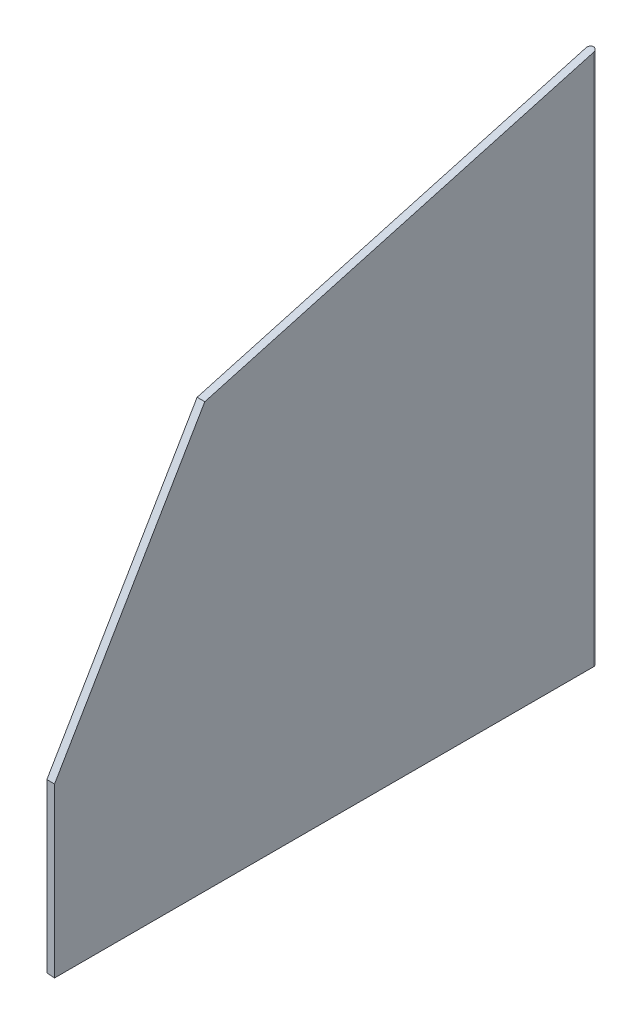
from build123d import *

# Parameters (mm, degrees)
BOSS_EXTRU_1_DEPTH           = 20
ENL_V_MAT_EXTRU_1_DEPTH      = 871
ENL_V_MAT_EXTRU_1_DEPTH_BACK = 792
ESQUISSE5_R                  = 5
ENL_V_MAT_EXTRU_2_DEPTH      = 20
CONG_1_R                     = 10


with BuildPart() as part:
    # Esquisse1 → Boss.-Extru.1 (new body)
    with BuildSketch(Plane(origin=(0, 0, 0), x_dir=(0, 0, -1), z_dir=(1, 0, 0))):
        Polygon((635.709590149, 813.74559194), (-385.471678665, 529.511856746), (-776.290409851, -136.25440806), (-776.290409851, -573.25440806), (635.709590149, -573.25440806), align=None)
    extrude(amount=BOSS_EXTRU_1_DEPTH)

    # Esquisse4 → Enlèv. mat.-Extru.1 (cut, two sides: drawn at the far end of the back side and taken through both)
    with BuildSketch(Plane.XY.offset(-ENL_V_MAT_EXTRU_1_DEPTH_BACK)):
        Polygon((0, -573.25440806), (0, -571.922503428), (20, -573.25440806), align=None)
    extrude(amount=ENL_V_MAT_EXTRU_1_DEPTH + ENL_V_MAT_EXTRU_1_DEPTH_BACK, mode=Mode.SUBTRACT)

    # Esquisse5 → Enlèv. mat.-Extru.2 (cut)
    with BuildSketch(Plane(origin=(-37.919143048, -569.397269313, 0), x_dir=(0.9977898861170226, -0.06644804859873017, 0), z_dir=(-0.06644804859873017, -0.9977898861170226, 0))):
        with Locations((48.027434489, -625.709590149)):
            Circle(ESQUISSE5_R)
    extrude(amount=-ENL_V_MAT_EXTRU_2_DEPTH, mode=Mode.SUBTRACT)

    # Congé1
    cong_1_edges = [part.edges().sort_by_distance(p)[0] for p in [
        (0, 120.911544256, -635.709590149),
        (20, 120.24559194, -635.709590149),
    ]]
    fillet(cong_1_edges, radius=CONG_1_R - 0.0001)  # a hair under: the kernel refuses the full size


solid = part.part
